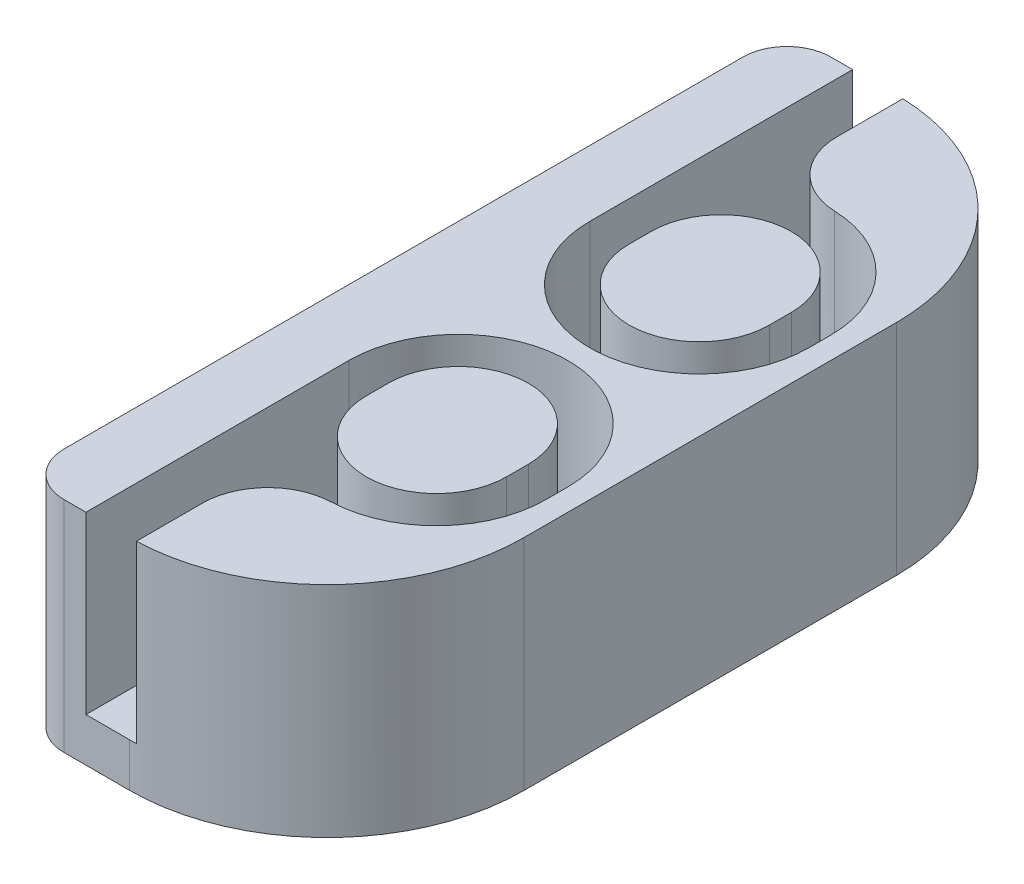
from build123d import *

# Parameters (mm, degrees)
BOSS_EXTRUDE3_DEPTH   = 8
BOSS_EXTRUDE3_2_DEPTH = 8
SKETCH4_W             = 14
SKETCH4_H             = 17.5
BOSS_EXTRUDE4_DEPTH   = 2
FILLET3_R             = 3
MIRROR2_START         = -2
MIRROR2_DEPTH         = 10
MIRROR2_2_DEPTH       = 2
CHAMFER1_SIZE         = 2
FILLET4_R             = 9
FILLET5_R             = 2


# Read off the part's stored shape, not the designer's step: Mirror2
with BuildPart() as part:
    # Sketch3 → Boss-Extrude3 (new body)
    with BuildSketch(Plane(origin=(0, 0, 0), x_dir=(1, 0, 0), z_dir=(0, 1, 0))):
        with BuildLine():
            Line((-1.7, -8.75), (7, -8.75))
            Line((7, -8.75), (7, 8.75))
            Line((7, 8.75), (-7, 8.75))
            Line((-7, 8.75), (-7, -8.75))
            Line((-7, -8.75), (-4, -8.75))
            Line((-4, -8.75), (-4, 3.25))
            ThreePointArc((-4, 3.25), (1, 8.25), (6, 3.25))
            Line((6, 3.25), (6, 2.25))
            ThreePointArc((6, 2.25), (3.397915762, -2.137482194), (-1.7, -1.958325083))
            Line((-1.7, -1.958325083), (-1.7, -8.75))
        make_face()
    extrude(amount=BOSS_EXTRUDE3_DEPTH)



with BuildPart() as body_2:
    # Sketch3 → Boss-Extrude3 2 (new body)
    with BuildSketch(Plane(origin=(0, 0, 0), x_dir=(1, 0, 0), z_dir=(0, 1, 0))):
        with BuildLine():
            ThreePointArc((-2.2, 2.25), (1, -0.95), (4.2, 2.25))
            Line((4.2, 2.25), (4.2, 3.25))
            ThreePointArc((4.2, 3.25), (1, 6.45), (-2.2, 3.25))
            Line((-2.2, 3.25), (-2.2, 2.25))
        make_face()
    extrude(amount=BOSS_EXTRUDE3_2_DEPTH)


with BuildPart() as part_1:
    add(part.part)

    add(body_2.part)  # Boss-Extrude4 merges body 2
    # Sketch4 → Boss-Extrude4 (add)
    with BuildSketch(Plane(origin=(0, 0, 0), x_dir=(-1, 0, 0), z_dir=(0, -1, 0))):
        Rectangle(SKETCH4_W, SKETCH4_H)
    extrude(amount=BOSS_EXTRUDE4_DEPTH)

    # Fillet3
    fillet3_edges = [part_1.edges().sort_by_distance(p)[0] for p in [
        (-1.7, 4, 1.958325083),
    ]]
    fillet(fillet3_edges, radius=FILLET3_R)

    # Mirror2 outline → Mirror2 (add)
    with BuildSketch(Plane(origin=(0, 0, 0), x_dir=(1, 0, 0), z_dir=(0, 1, 0)).offset(MIRROR2_START)):
        with BuildLine():
            ThreePointArc((1.1875, 20.246483138), (4.601215073, 18.718609231), (6, 15.25))
            Line((6, 15.25), (6, 14.25))
            ThreePointArc((6, 14.25), (1, 9.25), (-4, 14.25))
            Line((-4, 14.25), (-4, 26.25))
            Line((-4, 26.25), (-7, 26.25))
            Line((-7, 26.25), (-7, 8.75))
            Line((-7, 8.75), (7, 8.75))
            Line((7, 8.75), (7, 26.25))
            Line((7, 26.25), (-1.7, 26.25))
            Line((-1.7, 26.25), (-1.7, 23.244373021))
            ThreePointArc((-1.7, 23.244373021), (-0.860729044, 21.163207482), (1.1875, 20.246483138))
        make_face()
        with BuildLine():
            ThreePointArc((-2.2, 14.25), (1, 11.05), (4.2, 14.25))
            Line((4.2, 14.25), (4.2, 15.25))
            ThreePointArc((4.2, 15.25), (1, 18.45), (-2.2, 15.25))
            Line((-2.2, 15.25), (-2.2, 14.25))
        make_face()
    extrude(amount=MIRROR2_DEPTH)

    # Mirror2 2 outline → Mirror2 2 (add)
    with BuildSketch(Plane(origin=(0, 0, 0), x_dir=(1, 0, 0), z_dir=(0, 1, 0)).offset(MIRROR2_START)):
        with BuildLine():
            Line((6, 14.25), (6, 15.25))
            ThreePointArc((6, 15.25), (4.601215073, 18.718609231), (1.1875, 20.246483138))
            ThreePointArc((1.1875, 20.246483138), (-0.860729044, 21.163207482), (-1.7, 23.244373021))
            Line((-1.7, 23.244373021), (-1.7, 26.25))
            Line((-1.7, 26.25), (-4, 26.25))
            Line((-4, 26.25), (-4, 14.25))
            ThreePointArc((-4, 14.25), (1, 9.25), (6, 14.25))
        make_face()
        with BuildLine():
            Line((4.2, 15.25), (4.2, 14.25))
            ThreePointArc((4.2, 14.25), (1, 11.05), (-2.2, 14.25))
            Line((-2.2, 14.25), (-2.2, 15.25))
            ThreePointArc((-2.2, 15.25), (1, 18.45), (4.2, 15.25))
        make_face(mode=Mode.SUBTRACT)
    extrude(amount=MIRROR2_2_DEPTH)

    # Chamfer1
    # the kernel refuses this chamfer: 2 mm, written as the material it adds along each edge
    with BuildSketch(Plane(origin=(1, 0, -14.25), x_dir=(1, 0, 0), z_dir=(0, 0, -1))) as chamfer1_piece_1:
        Polygon((3.2 + CHAMFER1_SIZE, 0), (3.2, -CHAMFER1_SIZE), (3.2, 0), align=None)
    revolve(axis=Axis((1, 0, -14.25), (0, -1, 0)), revolution_arc=180)
    with BuildSketch(Plane(origin=(-2.2, 0, -14.25), x_dir=(-0.9996219169112968, -0.027495876610586365, 0), z_dir=(0, 0, -1)), Plane(origin=(4.2, 0, -15.25), x_dir=(0.9996219169112968, -0.027495876610586365, 0), z_dir=(0, 0, 1))) as chamfer1_piece_2:
        Polygon((CHAMFER1_SIZE * 0.999621916911, CHAMFER1_SIZE * 0.0274958766106), (-CHAMFER1_SIZE * 0.0274958766106, CHAMFER1_SIZE * 0.999621916911), (0, 0), align=None)
    extrude(amount=1)
    with BuildSketch(Plane(origin=(1, 0, -15.25), x_dir=(-1, 0, 0), z_dir=(0, 0, 1))) as chamfer1_piece_3:
        Polygon((3.2 + CHAMFER1_SIZE, 0), (3.2, -CHAMFER1_SIZE), (3.2, 0), align=None)
    revolve(axis=Axis((1, 0, -15.25), (0, -1, 0)), revolution_arc=180)
    with BuildSketch(Plane(origin=(1, 0, -3.25), x_dir=(1, 0, 0), z_dir=(0, 0, 1))) as chamfer1_piece_4:
        Polygon((3.2 + CHAMFER1_SIZE, 0), (3.2, CHAMFER1_SIZE), (3.2, 0), align=None)
    revolve(axis=Axis((1, 0, -3.25), (0, 1, 0)), revolution_arc=180)
    with BuildSketch(Plane(origin=(-2.2, 0, -3.25), x_dir=(-0.9996219169112968, -0.027495876610586365, 0), z_dir=(0, 0, 1)), Plane(origin=(4.2, 0, -2.25), x_dir=(0.9996219169112968, -0.027495876610586365, 0), z_dir=(0, 0, -1))) as chamfer1_piece_5:
        Polygon((CHAMFER1_SIZE * 0.999621916911, -CHAMFER1_SIZE * 0.0274958766106), (-CHAMFER1_SIZE * 0.0274958766106, -CHAMFER1_SIZE * 0.999621916911), (0, 0), align=None)
    extrude(amount=1)
    with BuildSketch(Plane(origin=(1, 0, -2.25), x_dir=(-1, 0, 0), z_dir=(0, 0, -1))) as chamfer1_piece_6:
        Polygon((3.2 + CHAMFER1_SIZE, 0), (3.2, CHAMFER1_SIZE), (3.2, 0), align=None)
    revolve(axis=Axis((1, 0, -2.25), (0, 1, 0)), revolution_arc=180)

    # Fillet4
    fillet4_edges = [part_1.edges().sort_by_distance(p)[0] for p in [
        (7, 3, 8.75),
        (7, 3, -26.25),
    ]]
    fillet(fillet4_edges, radius=FILLET4_R)

    # Fillet5
    fillet5_edges = [part_1.edges().sort_by_distance(p)[0] for p in [
        (-7, 3, 8.75),
        (-7, 3, -26.25),
    ]]
    fillet(fillet5_edges, radius=FILLET5_R)


solid = part_1.part
